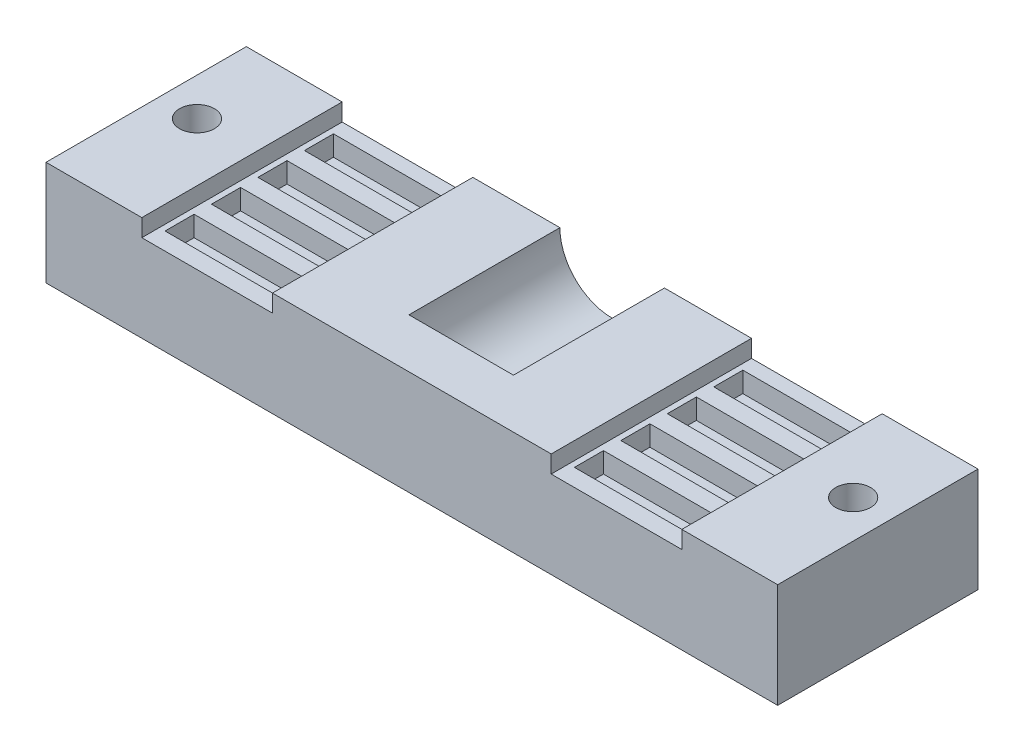
from build123d import *

# Parameters (mm, degrees)
SALIENTE_EXTRUIR1_DEPTH = 34.5
CROQUIS2_R              = 9
CORTAR_EXTRUIR1_DEPTH   = 26
CROQUIS3_W              = 20.5
CROQUIS3_H              = 5
CORTAR_EXTRUIR2_DEPTH   = 3.5
CROQUIS4_R              = 3
CORTAR_EXTRUIR3_DEPTH   = 132.872097124


with BuildPart() as part:
    # Croquis1 → Saliente-Extruir1 (new body)
    with BuildSketch(Plane.XY):
        Polygon((0, 0), (0, 18), (16.5, 18), (16.5, 15), (39, 15), (39, 18), (87, 18), (87, 15), (109.5, 15), (109.5, 18), (126, 18), (126, 0), align=None)
    extrude(amount=SALIENTE_EXTRUIR1_DEPTH)

    # Croquis2 → Cortar-Extruir1 (cut)
    with BuildSketch(Plane(origin=(0, 0, 0), x_dir=(-1, 0, 0), z_dir=(0, 0, -1))):
        with Locations((-63, 18)):
            Circle(CROQUIS2_R)
    extrude(amount=-CORTAR_EXTRUIR1_DEPTH, mode=Mode.SUBTRACT)

    # Croquis3 → Cortar-Extruir2 (cut)
    with BuildSketch(Plane(origin=(0, 15, 0), x_dir=(1, 0, 0), z_dir=(0, 1, 0))):
        with Locations((27.75, -29)):
            Rectangle(CROQUIS3_W, CROQUIS3_H)
        with Locations((27.75, -21)):
            Rectangle(CROQUIS3_W, CROQUIS3_H)
        with Locations((27.75, -13)):
            Rectangle(CROQUIS3_W, CROQUIS3_H)
        with Locations((27.75, -5)):
            Rectangle(CROQUIS3_W, CROQUIS3_H)
        with Locations((98.25, -29)):
            Rectangle(CROQUIS3_W, CROQUIS3_H)
        with Locations((98.25, -21)):
            Rectangle(CROQUIS3_W, CROQUIS3_H)
        with Locations((98.25, -13)):
            Rectangle(CROQUIS3_W, CROQUIS3_H)
        with Locations((98.25, -5)):
            Rectangle(CROQUIS3_W, CROQUIS3_H)
    extrude(amount=-CORTAR_EXTRUIR2_DEPTH, mode=Mode.SUBTRACT)

    # Croquis4 → Cortar-Extruir3 (cut, through all)
    with BuildSketch(Plane(origin=(0, 18, 0), x_dir=(1, 0, 0), z_dir=(0, 1, 0))):
        with Locations((6.5, -15)):
            Circle(CROQUIS4_R)
    cortar_extruir3 = extrude(amount=-CORTAR_EXTRUIR3_DEPTH, mode=Mode.SUBTRACT)

    # Simetría1: Cortar-Extruir3 across plane
    add(cortar_extruir3.mirror(Plane.ZY.offset(-63)), mode=Mode.SUBTRACT)


solid = part.part
